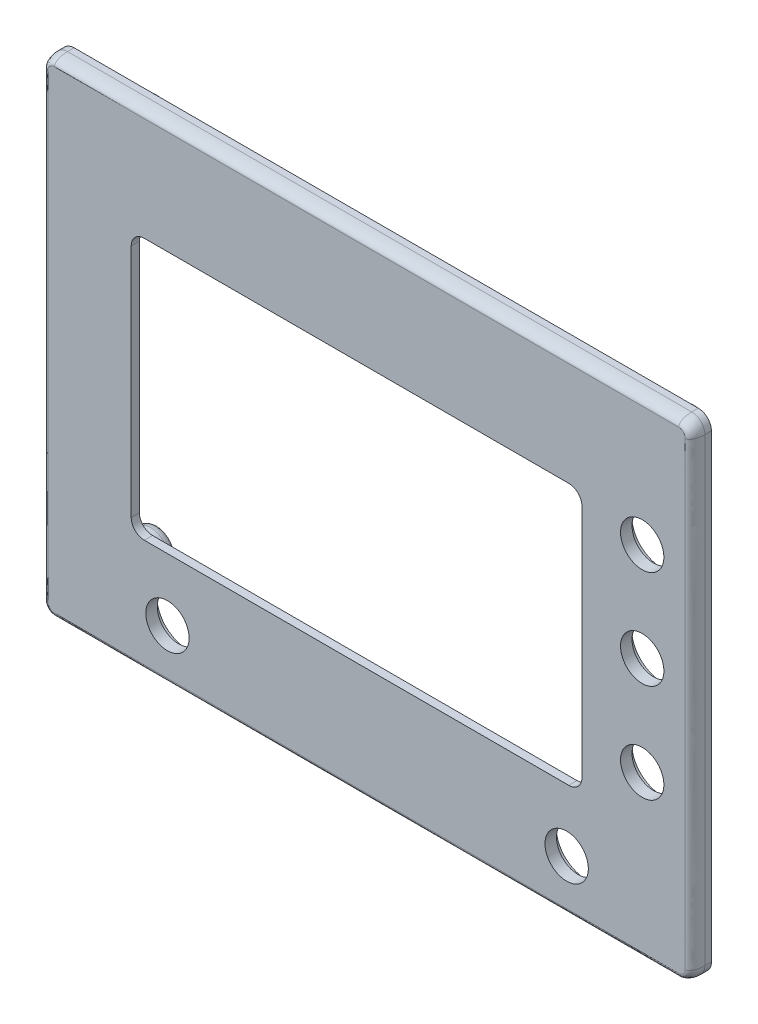
from build123d import *

# Parameters (mm, degrees)
DODANIE_WYCI_GNI_CIE1_DEPTH = 3
OTW_R_3_0_3_1_D             = 3
OTW_R_3_0_3_1_DEPTH         = 19.05
OTW_R_3_0_3_1_TIP           = 0.901290929
OTW_R_6_0_6_1_D             = 6
OTW_R_6_0_6_1_DEPTH         = 19.05
OTW_R_6_0_6_1_TIP           = 1.802581857
SZKIC8_W                    = 68.6
SZKIC8_H                    = 39.8
WYTNIJ_WYCI_GNI_CIE1_DEPTH  = 62.872853498
SZKIC9_W                    = 74.6
SZKIC9_H                    = 45.8
WYTNIJ_WYCI_GNI_CIE2_DEPTH  = 1.75
ZAOKR_GLENIE1_R             = 2
WYTNIJ_WYCI_GNI_CIE3_DEPTH  = 0.5
DODANIE_WYCI_GNI_CIE2_START = 6
SZKIC12_R                   = 3
SZKIC12_R_2                 = 1.5
DODANIE_WYCI_GNI_CIE2_DEPTH = 6
ZAOKR_GLENIE2_SIZE          = 2
ZAOKR_GLENIE2_SIZE_2        = 5
SZKIC13_R                   = 3.3
WYTNIJ_WYCI_GNI_CIE4_DEPTH  = 63.090659523
SZKIC14_R                   = 4.6
WYTNIJ_WYCI_GNI_CIE5_DEPTH  = 1.25
ZAOKR_GLENIE3_SIZE          = 1
ZAOKR_GLENIE3_SIZE_2        = 0.5
DODANIE_WYCI_GNI_CIE3_START = -1
SZKIC15_R                   = 1.5
DODANIE_WYCI_GNI_CIE3_DEPTH = 1
ZAOKR_GLENIE4_SIZE          = 1
ZAOKR_GLENIE4_SIZE_2        = 2


with BuildPart() as part:
    # Szkic1 → Dodanie-wyciągnięcie1 (new body)
    with BuildSketch(Plane.XY):
        with BuildLine():
            Line((49.5, -35), (49.5, 35))
            ThreePointArc((49.5, 35), (48.914213562, 36.414213562), (47.5, 37))
            Line((47.5, 37), (-47.5, 37))
            ThreePointArc((-47.5, 37), (-48.914213562, 36.414213562), (-49.5, 35))
            Line((-49.5, 35), (-49.5, -35))
            ThreePointArc((-49.5, -35), (-48.914213562, -36.414213562), (-47.5, -37))
            Line((-47.5, -37), (47.5, -37))
            ThreePointArc((47.5, -37), (48.914213562, -36.414213562), (49.5, -35))
        make_face()
    extrude(amount=DODANIE_WYCI_GNI_CIE1_DEPTH)

    # Otwór Ø3.0 (3)1
    with Locations(Plane.XY.offset(3)):
        with Locations((-40.925, 28.425), (40.925, 28.425), (40.925, -28.425), (-40.925, -28.425)):
            Hole(OTW_R_3_0_3_1_D / 2, depth=OTW_R_3_0_3_1_DEPTH)
            with Locations((0, 0, -(OTW_R_3_0_3_1_DEPTH + OTW_R_3_0_3_1_TIP / 2))):  # 118° drill point
                Cone(0, OTW_R_3_0_3_1_D / 2, OTW_R_3_0_3_1_TIP, mode=Mode.SUBTRACT)

    # Otwór Ø6.0 (6)1
    with Locations(Plane.XY.offset(3)):
        with Locations((41.96, 17.73), (41.96, 2.73), (41.96, -12.27), (30.46, -29.07), (-30.3, -29.07)):
            Hole(OTW_R_6_0_6_1_D / 2, depth=OTW_R_6_0_6_1_DEPTH)
            with Locations((0, 0, -(OTW_R_6_0_6_1_DEPTH + OTW_R_6_0_6_1_TIP / 2))):  # 118° drill point
                Cone(0, OTW_R_6_0_6_1_D / 2, OTW_R_6_0_6_1_TIP, mode=Mode.SUBTRACT)

    # Szkic8 → Wytnij-wyciągnięcie1 (cut, through all)
    with BuildSketch(Plane.XY.offset(3)):
        with Locations((-1.513487197, 0.33)):
            Rectangle(SZKIC8_W, SZKIC8_H)
    extrude(amount=-WYTNIJ_WYCI_GNI_CIE1_DEPTH, mode=Mode.SUBTRACT)

    # Szkic9 → Wytnij-wyciągnięcie2 (cut)
    with BuildSketch(Plane(origin=(0, 0, 0), x_dir=(-1, 0, 0), z_dir=(0, 0, -1))):
        with Locations((1.513487197, 0.33)):
            Rectangle(SZKIC9_W, SZKIC9_H)
    extrude(amount=-WYTNIJ_WYCI_GNI_CIE2_DEPTH, mode=Mode.SUBTRACT)

    # Zaokrąglenie1
    zaokr_glenie1_edges = [part.edges().sort_by_distance(p)[0] for p in [
        (-35.813487197, -19.57, 2.375),
        (32.786512803, -19.57, 2.375),
        (-35.813487197, 20.23, 2.375),
        (32.786512803, 20.23, 2.375),
    ]]
    fillet(zaokr_glenie1_edges, radius=ZAOKR_GLENIE1_R)

    # Szkic10 → Wytnij-wyciągnięcie3 (cut)
    with BuildSketch(Plane(origin=(0, 0, 1.75), x_dir=(-1, 0, 0), z_dir=(0, 0, -1))):
        with BuildLine():
            Line((-34.786512803, 18.23), (-34.786512803, -17.57))
            ThreePointArc((-34.786512803, -17.57), (-33.614939928, -20.398427125), (-30.786512803, -21.57))
            Line((-30.786512803, -21.57), (33.813487197, -21.57))
            ThreePointArc((33.813487197, -21.57), (36.641914321, -20.398427125), (37.813487197, -17.57))
            Line((37.813487197, -17.57), (37.813487197, 18.23))
            ThreePointArc((37.813487197, 18.23), (36.641914321, 21.058427125), (33.813487197, 22.23))
            Line((33.813487197, 22.23), (-30.786512803, 22.23))
            ThreePointArc((-30.786512803, 22.23), (-33.614939928, 21.058427125), (-34.786512803, 18.23))
        make_face()
        with BuildLine():
            Line((-33.786512803, 18.23), (-33.786512803, -17.57))
            ThreePointArc((-33.786512803, -17.57), (-32.907833147, -19.691320344), (-30.786512803, -20.57))
            Line((-30.786512803, -20.57), (33.813487197, -20.57))
            ThreePointArc((33.813487197, -20.57), (35.93480754, -19.691320344), (36.813487197, -17.57))
            Line((36.813487197, -17.57), (36.813487197, 18.23))
            ThreePointArc((36.813487197, 18.23), (35.93480754, 20.351320344), (33.813487197, 21.23))
            Line((33.813487197, 21.23), (-30.786512803, 21.23))
            ThreePointArc((-30.786512803, 21.23), (-32.907833147, 20.351320344), (-33.786512803, 18.23))
        make_face(mode=Mode.SUBTRACT)
    extrude(amount=-WYTNIJ_WYCI_GNI_CIE3_DEPTH, mode=Mode.SUBTRACT)

    # Szkic12 → Dodanie-wyciągnięcie2 (add)
    # profile 1 of 4: a face of its own
    with BuildSketch(Plane(origin=(0, 0, 0), x_dir=(-1, 0, 0), z_dir=(0, 0, -1)).offset(DODANIE_WYCI_GNI_CIE2_START)):
        with Locations(Location((-40.925, 28.425, 0), (0, 0, 180))):
            Circle(SZKIC12_R)
        with Locations(Location((-40.925, 28.425, 0), (0, 0, 180))):
            Circle(SZKIC12_R_2, mode=Mode.SUBTRACT)
    # profile 2 of 4: a face of its own
    with BuildSketch(Plane(origin=(0, 0, 0), x_dir=(-1, 0, 0), z_dir=(0, 0, -1)).offset(DODANIE_WYCI_GNI_CIE2_START)):
        with Locations(Location((40.925, 28.425, 0), (0, 0, 180))):
            Circle(SZKIC12_R)
        with Locations(Location((40.925, 28.425, 0), (0, 0, 180))):
            Circle(SZKIC12_R_2, mode=Mode.SUBTRACT)
    # profile 3 of 4: a face of its own
    with BuildSketch(Plane(origin=(0, 0, 0), x_dir=(-1, 0, 0), z_dir=(0, 0, -1)).offset(DODANIE_WYCI_GNI_CIE2_START)):
        with Locations(Location((40.925, -28.425, 0), (0, 0, 180))):
            Circle(SZKIC12_R)
        with Locations(Location((40.925, -28.425, 0), (0, 0, 180))):
            Circle(SZKIC12_R_2, mode=Mode.SUBTRACT)
    # profile 4 of 4: a face of its own
    with BuildSketch(Plane(origin=(0, 0, 0), x_dir=(-1, 0, 0), z_dir=(0, 0, -1)).offset(DODANIE_WYCI_GNI_CIE2_START)):
        with Locations(Location((-40.925, -28.425, 0), (0, 0, 180))):
            Circle(SZKIC12_R)
        with Locations(Location((-40.925, -28.425, 0), (0, 0, 180))):
            Circle(SZKIC12_R_2, mode=Mode.SUBTRACT)
    extrude(amount=-DODANIE_WYCI_GNI_CIE2_DEPTH)

    # Zaokrąglenie2
    # an asymmetric fillet: 5, 2 mm, written as the material it adds along each edge
    with BuildSketch(Plane(origin=(40.925, 28.425, 0), x_dir=(1, 0, 0), z_dir=(0, 1, 0))) as zaokr_glenie2_piece_1:
        with BuildLine():
            Bezier((3 + ZAOKR_GLENIE2_SIZE, 0), (3, 0), (3, ZAOKR_GLENIE2_SIZE_2), weights=[1, 0.707106781, 1])
            Line((3, ZAOKR_GLENIE2_SIZE_2), (3, 0))
            Line((3, 0), (3 + ZAOKR_GLENIE2_SIZE, 0))
        make_face()
    revolve(axis=Axis((40.925, 28.425, 0), (0, 0, -1)))
    with BuildSketch(Plane(origin=(-40.925, 28.425, 0), x_dir=(1, 0, 0), z_dir=(0, 1, 0))) as zaokr_glenie2_piece_2:
        with BuildLine():
            Bezier((3 + ZAOKR_GLENIE2_SIZE, 0), (3, 0), (3, ZAOKR_GLENIE2_SIZE_2), weights=[1, 0.707106781, 1])
            Line((3, ZAOKR_GLENIE2_SIZE_2), (3, 0))
            Line((3, 0), (3 + ZAOKR_GLENIE2_SIZE, 0))
        make_face()
    revolve(axis=Axis((-40.925, 28.425, 0), (0, 0, -1)))
    with BuildSketch(Plane(origin=(-40.925, -28.425, 0), x_dir=(1, 0, 0), z_dir=(0, 1, 0))) as zaokr_glenie2_piece_3:
        with BuildLine():
            Bezier((3 + ZAOKR_GLENIE2_SIZE, 0), (3, 0), (3, ZAOKR_GLENIE2_SIZE_2), weights=[1, 0.707106781, 1])
            Line((3, ZAOKR_GLENIE2_SIZE_2), (3, 0))
            Line((3, 0), (3 + ZAOKR_GLENIE2_SIZE, 0))
        make_face()
    revolve(axis=Axis((-40.925, -28.425, 0), (0, 0, -1)))
    with BuildSketch(Plane(origin=(40.925, -28.425, 0), x_dir=(1, 0, 0), z_dir=(0, 1, 0))) as zaokr_glenie2_piece_4:
        with BuildLine():
            Bezier((3 + ZAOKR_GLENIE2_SIZE, 0), (3, 0), (3, ZAOKR_GLENIE2_SIZE_2), weights=[1, 0.707106781, 1])
            Line((3, ZAOKR_GLENIE2_SIZE_2), (3, 0))
            Line((3, 0), (3 + ZAOKR_GLENIE2_SIZE, 0))
        make_face()
    revolve(axis=Axis((40.925, -28.425, 0), (0, 0, -1)))

    # Szkic13 → Wytnij-wyciągnięcie4 (cut, through all)
    with BuildSketch(Plane(origin=(0, 0, 0), x_dir=(-1, 0, 0), z_dir=(0, 0, -1))):
        with Locations((-41.96, -12.27)):
            Circle(SZKIC13_R)
        with Locations((-41.96, 2.73)):
            Circle(SZKIC13_R)
        with Locations((-41.96, 17.73)):
            Circle(SZKIC13_R)
        with Locations((-30.46, -29.07)):
            Circle(SZKIC13_R)
        with Locations((30.3, -29.07)):
            Circle(SZKIC13_R)
    extrude(amount=-WYTNIJ_WYCI_GNI_CIE4_DEPTH, mode=Mode.SUBTRACT)

    # Szkic14 → Wytnij-wyciągnięcie5 (cut)
    with BuildSketch(Plane(origin=(0, 0, 0), x_dir=(-1, 0, 0), z_dir=(0, 0, -1))):
        with Locations((-41.96, 17.73)):
            Circle(SZKIC14_R)
        with Locations((-41.96, 2.73)):
            Circle(SZKIC14_R)
        with Locations((-41.96, -12.27)):
            Circle(SZKIC14_R)
        with Locations((-30.46, -29.07)):
            Circle(SZKIC14_R)
        with Locations((30.3, -29.07)):
            Circle(SZKIC14_R)
    extrude(amount=-WYTNIJ_WYCI_GNI_CIE5_DEPTH, mode=Mode.SUBTRACT)

    # Zaokrąglenie3
    # an asymmetric fillet: 1, 0.5 mm, written as the material it takes off along each edge
    with BuildSketch(Plane(origin=(40.925, 28.425, -6), x_dir=(1, 0, 0), z_dir=(0, 1, 0))) as zaokr_glenie3_piece_1:
        with BuildLine():
            Bezier((3, -ZAOKR_GLENIE3_SIZE), (3, 0), (3 - ZAOKR_GLENIE3_SIZE_2, 0), weights=[1, 0.707106781, 1])
            Line((3 - ZAOKR_GLENIE3_SIZE_2, 0), (3, 0))
            Line((3, 0), (3, -ZAOKR_GLENIE3_SIZE))
        make_face()
    revolve(axis=Axis((40.925, 28.425, -6), (0, 0, -1)), mode=Mode.SUBTRACT)
    with BuildSketch(Plane(origin=(-40.925, 28.425, -6), x_dir=(1, 0, 0), z_dir=(0, 1, 0))) as zaokr_glenie3_piece_2:
        with BuildLine():
            Bezier((3, -ZAOKR_GLENIE3_SIZE), (3, 0), (3 - ZAOKR_GLENIE3_SIZE_2, 0), weights=[1, 0.707106781, 1])
            Line((3 - ZAOKR_GLENIE3_SIZE_2, 0), (3, 0))
            Line((3, 0), (3, -ZAOKR_GLENIE3_SIZE))
        make_face()
    revolve(axis=Axis((-40.925, 28.425, -6), (0, 0, -1)), mode=Mode.SUBTRACT)
    with BuildSketch(Plane(origin=(-40.925, -28.425, -6), x_dir=(1, 0, 0), z_dir=(0, 1, 0))) as zaokr_glenie3_piece_3:
        with BuildLine():
            Bezier((3, -ZAOKR_GLENIE3_SIZE), (3, 0), (3 - ZAOKR_GLENIE3_SIZE_2, 0), weights=[1, 0.707106781, 1])
            Line((3 - ZAOKR_GLENIE3_SIZE_2, 0), (3, 0))
            Line((3, 0), (3, -ZAOKR_GLENIE3_SIZE))
        make_face()
    revolve(axis=Axis((-40.925, -28.425, -6), (0, 0, -1)), mode=Mode.SUBTRACT)
    with BuildSketch(Plane(origin=(40.925, -28.425, -6), x_dir=(1, 0, 0), z_dir=(0, 1, 0))) as zaokr_glenie3_piece_4:
        with BuildLine():
            Bezier((3, -ZAOKR_GLENIE3_SIZE), (3, 0), (3 - ZAOKR_GLENIE3_SIZE_2, 0), weights=[1, 0.707106781, 1])
            Line((3 - ZAOKR_GLENIE3_SIZE_2, 0), (3, 0))
            Line((3, 0), (3, -ZAOKR_GLENIE3_SIZE))
        make_face()
    revolve(axis=Axis((40.925, -28.425, -6), (0, 0, -1)), mode=Mode.SUBTRACT)

    # Szkic15 → Dodanie-wyciągnięcie3 (add)
    with BuildSketch(Plane.XY.offset(3).offset(DODANIE_WYCI_GNI_CIE3_START)):
        with Locations((40.925, 28.425)):
            Circle(SZKIC15_R)
        with Locations((-40.925, 28.425)):
            Circle(SZKIC15_R)
        with Locations((-40.925, -28.425)):
            Circle(SZKIC15_R)
        with Locations((40.925, -28.425)):
            Circle(SZKIC15_R)
    extrude(amount=DODANIE_WYCI_GNI_CIE3_DEPTH)

    # Zaokrąglenie4
    # an asymmetric fillet: 2, 1 mm, written as the material it takes off along each edge
    with BuildSketch(Plane(origin=(47.5, 37, 3), x_dir=(0, -1, 0), z_dir=(-1, 0, 0)), Plane(origin=(-47.5, -37, 3), x_dir=(0, 1, 0), z_dir=(1, 0, 0))) as zaokr_glenie4_piece_1:
        with BuildLine():
            Bezier((ZAOKR_GLENIE4_SIZE, 0), (0, 0), (0, -ZAOKR_GLENIE4_SIZE_2), weights=[1, 0.707106781, 1])
            Line((0, -ZAOKR_GLENIE4_SIZE_2), (0, 0))
            Line((0, 0), (ZAOKR_GLENIE4_SIZE, 0))
        make_face()
    extrude(amount=95, mode=Mode.SUBTRACT)
    with BuildSketch(Plane(origin=(-47.5, 35, 3), x_dir=(0, 1, 0), z_dir=(1, 0, 0))) as zaokr_glenie4_piece_2:
        with BuildLine():
            Bezier((2 - ZAOKR_GLENIE4_SIZE, 0), (2, 0), (2, -ZAOKR_GLENIE4_SIZE_2), weights=[1, 0.707106781, 1])
            Line((2, -ZAOKR_GLENIE4_SIZE_2), (2, 0))
            Line((2, 0), (2 - ZAOKR_GLENIE4_SIZE, 0))
        make_face()
    revolve(axis=Axis((-47.5, 35, 3), (0, 0, 1)), revolution_arc=90, mode=Mode.SUBTRACT)
    with BuildSketch(Plane(origin=(47.5, 35, 3), x_dir=(1, 0, 0), z_dir=(0, -1, 0))) as zaokr_glenie4_piece_3:
        with BuildLine():
            Bezier((2 - ZAOKR_GLENIE4_SIZE, 0), (2, 0), (2, -ZAOKR_GLENIE4_SIZE_2), weights=[1, 0.707106781, 1])
            Line((2, -ZAOKR_GLENIE4_SIZE_2), (2, 0))
            Line((2, 0), (2 - ZAOKR_GLENIE4_SIZE, 0))
        make_face()
    revolve(axis=Axis((47.5, 35, 3), (0, 0, 1)), revolution_arc=90, mode=Mode.SUBTRACT)
    with BuildSketch(Plane(origin=(-49.5, 35, 3), x_dir=(1, 0, 0), z_dir=(0, -1, 0)), Plane(origin=(49.5, -35, 3), x_dir=(-1, 0, 0), z_dir=(0, 1, 0))) as zaokr_glenie4_piece_4:
        with BuildLine():
            Bezier((ZAOKR_GLENIE4_SIZE, 0), (0, 0), (0, -ZAOKR_GLENIE4_SIZE_2), weights=[1, 0.707106781, 1])
            Line((0, -ZAOKR_GLENIE4_SIZE_2), (0, 0))
            Line((0, 0), (ZAOKR_GLENIE4_SIZE, 0))
        make_face()
    extrude(amount=70, mode=Mode.SUBTRACT)
    with BuildSketch(Plane(origin=(-47.5, -35, 3), x_dir=(-1, 0, 0), z_dir=(0, 1, 0))) as zaokr_glenie4_piece_5:
        with BuildLine():
            Bezier((2 - ZAOKR_GLENIE4_SIZE, 0), (2, 0), (2, -ZAOKR_GLENIE4_SIZE_2), weights=[1, 0.707106781, 1])
            Line((2, -ZAOKR_GLENIE4_SIZE_2), (2, 0))
            Line((2, 0), (2 - ZAOKR_GLENIE4_SIZE, 0))
        make_face()
    revolve(axis=Axis((-47.5, -35, 3), (0, 0, 1)), revolution_arc=90, mode=Mode.SUBTRACT)
    with BuildSketch(Plane(origin=(47.5, -35, 3), x_dir=(0, -1, 0), z_dir=(-1, 0, 0))) as zaokr_glenie4_piece_6:
        with BuildLine():
            Bezier((2 - ZAOKR_GLENIE4_SIZE, 0), (2, 0), (2, -ZAOKR_GLENIE4_SIZE_2), weights=[1, 0.707106781, 1])
            Line((2, -ZAOKR_GLENIE4_SIZE_2), (2, 0))
            Line((2, 0), (2 - ZAOKR_GLENIE4_SIZE, 0))
        make_face()
    revolve(axis=Axis((47.5, -35, 3), (0, 0, 1)), revolution_arc=90, mode=Mode.SUBTRACT)


solid = part.part
